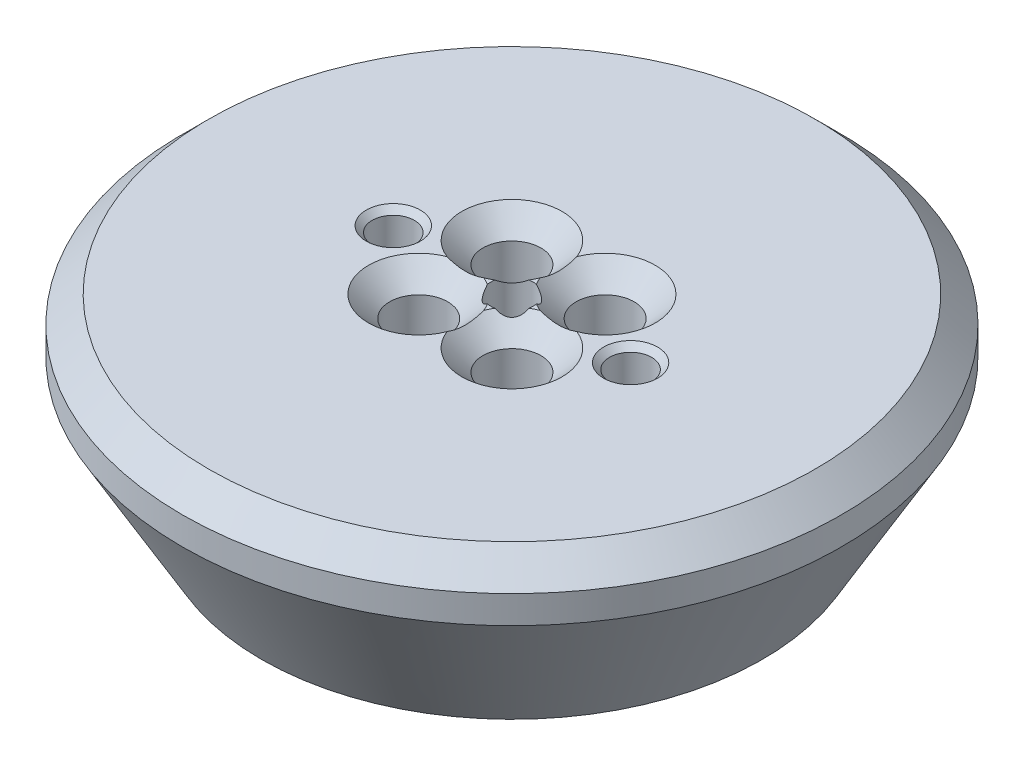
from build123d import *

# Parameters (mm, degrees)
SKETCH1_R                                       = 12.5
BOSS_EXTRUDE1_DEPTH                             = 3
CUT_EXTRUDE1_DEPTH                              = 18.930421077
CUT_EXTRUDE1_DEPTH_BACK                         = 18.930421077
SKETCH2_R                                       = 0.8
CSK_FOR_M2_FLAT_HEAD_MACHINE_SCREW1_D           = 2.2
CSK_FOR_M2_FLAT_HEAD_MACHINE_SCREW1_DEPTH       = 5
CSK_FOR_M2_FLAT_HEAD_MACHINE_SCREW1_CSINK_D     = 3.8
CSK_FOR_M2_FLAT_HEAD_MACHINE_SCREW1_CSINK_ANGLE = 90
CSK_FOR_M2_FLAT_HEAD_MACHINE_SCREW1_TIP         = 0.660946681
BOSS_EXTRUDE2_START                             = 3
SKETCH7_R                                       = 12.5
SKETCH7_R_2                                     = 7.2
BOSS_EXTRUDE2_DEPTH                             = 3
FILLET1_R                                       = 1
CHAMFER1_SIZE                                   = 1
CHAMFER2_SIZE                                   = 1
CHAMFER3_SIZE                                   = 3
CHAMFER3_SIZE2                                  = 5.196152423
M2X0_4_TAPPED_HOLE1_D                           = 1.6
M2X0_4_TAPPED_HOLE1_DEPTH                       = 5.2
M2X0_4_TAPPED_HOLE1_CSINK_D                     = 2.05
M2X0_4_TAPPED_HOLE1_CSINK_ANGLE                 = 90
M2X0_4_TAPPED_HOLE1_TIP                         = 0.480688495


with BuildPart() as part:
    # Sketch1 → Boss-Extrude1 (new body)
    with BuildSketch(Plane(origin=(0, 0, 0), x_dir=(1, 0, 0), z_dir=(0, 1, 0))):
        Circle(SKETCH1_R)
    extrude(amount=BOSS_EXTRUDE1_DEPTH)

    # Sketch2 → Cut-Extrude1 (cut, two sides: drawn at the far end of the back side and taken through both)
    with BuildSketch(Plane(origin=(0, 3, 0), x_dir=(1, 0, 0), z_dir=(0, 1, 0)).offset(-CUT_EXTRUDE1_DEPTH_BACK)):
        Circle(SKETCH2_R)
    extrude(amount=CUT_EXTRUDE1_DEPTH + CUT_EXTRUDE1_DEPTH_BACK, mode=Mode.SUBTRACT)

    # CSK for M2 Flat Head Machine Screw1
    with Locations(Plane(origin=(0, 3, 0), x_dir=(1, 0, 0), z_dir=(0, 1, 0))):
        with Locations((-1.767766953, 1.767766953), (1.767766953, 1.767766953), (1.767766953, -1.767766953), (-1.767766953, -1.767766953)):
            CounterSinkHole(CSK_FOR_M2_FLAT_HEAD_MACHINE_SCREW1_D / 2, CSK_FOR_M2_FLAT_HEAD_MACHINE_SCREW1_CSINK_D / 2, depth=CSK_FOR_M2_FLAT_HEAD_MACHINE_SCREW1_DEPTH, counter_sink_angle=CSK_FOR_M2_FLAT_HEAD_MACHINE_SCREW1_CSINK_ANGLE)
            with Locations((0, 0, -(CSK_FOR_M2_FLAT_HEAD_MACHINE_SCREW1_DEPTH + CSK_FOR_M2_FLAT_HEAD_MACHINE_SCREW1_TIP / 2))):  # 118° drill point
                Cone(0, CSK_FOR_M2_FLAT_HEAD_MACHINE_SCREW1_D / 2, CSK_FOR_M2_FLAT_HEAD_MACHINE_SCREW1_TIP, mode=Mode.SUBTRACT)

    # Sketch6 → Revolve1 (revolve)
    with BuildSketch(Plane.XY):
        Polygon((-12.5, 0), (-12.5, -1.25), (-7.2, -1.25), (-5, 0), align=None)
    revolve(axis=Axis((0, 0, 0), (0, -1, 0)))

    # Sketch7 → Boss-Extrude2 (add)
    with BuildSketch(Plane.XZ.offset(1.25).offset(BOSS_EXTRUDE2_START)):
        Circle(SKETCH7_R)
        Circle(SKETCH7_R_2, mode=Mode.SUBTRACT)
    extrude(amount=-BOSS_EXTRUDE2_DEPTH)

    # Fillet1
    fillet1_edges = [part.edges().sort_by_distance(p)[0] for p in [
        (5, 0, 0),
        (0, -1.25, 7.2),
    ]]
    fillet(fillet1_edges, radius=FILLET1_R)

    # Chamfer1
    chamfer1_edges = [part.edges().sort_by_distance(p)[0] for p in [
        (-12.5, 3, 0),
    ]]
    chamfer(chamfer1_edges, length=CHAMFER1_SIZE)

    # Chamfer2
    chamfer2_edges = [part.edges().sort_by_distance(p)[0] for p in [
        (-7.2, -4.25, 0),
    ]]
    chamfer(chamfer2_edges, length=CHAMFER2_SIZE)

    # Chamfer3
    chamfer3_edges = [part.edges().sort_by_distance(p)[0] for p in [
        (-12.5, -4.25, 0),
    ]]
    chamfer3_side = [part.faces().sort_by_distance(p)[0] for p in [
        (-8.553553391, -4.25, 0),
    ]]
    chamfer(chamfer3_edges, length=CHAMFER3_SIZE, length2=CHAMFER3_SIZE2, reference=chamfer3_side[0])

    # M2x0.4 Tapped Hole1
    with Locations(Plane(origin=(0, 3, 0), x_dir=(1, 0, 0), z_dir=(0, 1, 0))):
        with Locations((-4.5, 0), (4.5, 0)):
            CounterSinkHole(M2X0_4_TAPPED_HOLE1_D / 2, M2X0_4_TAPPED_HOLE1_CSINK_D / 2, depth=M2X0_4_TAPPED_HOLE1_DEPTH, counter_sink_angle=M2X0_4_TAPPED_HOLE1_CSINK_ANGLE)
            with Locations((0, 0, -(M2X0_4_TAPPED_HOLE1_DEPTH + M2X0_4_TAPPED_HOLE1_TIP / 2))):  # 118° drill point
                Cone(0, M2X0_4_TAPPED_HOLE1_D / 2, M2X0_4_TAPPED_HOLE1_TIP, mode=Mode.SUBTRACT)


solid = part.part
